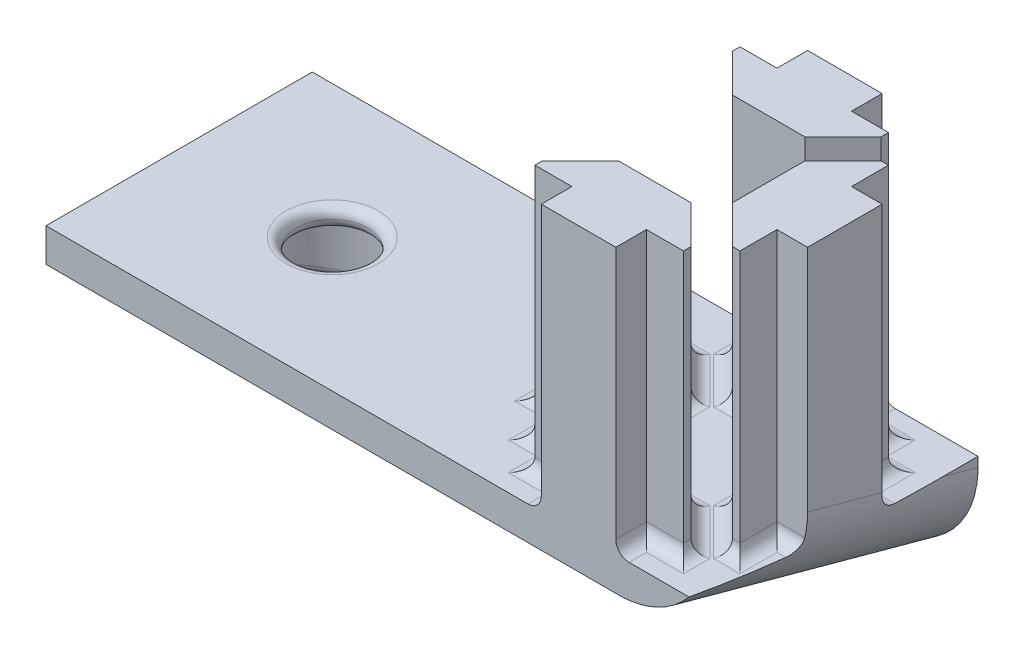
from build123d import *

# Parameters (mm, degrees)
BOSS_EXTRUDE1_DEPTH   = 20
BOSS_EXTRUDE1_2_DEPTH = 20
BOSS_EXTRUDE1_3_DEPTH = 20
BOSS_EXTRUDE1_4_DEPTH = 20
SKETCH2_W             = 20
SKETCH2_H             = 20
BOSS_EXTRUDE2_DEPTH   = 20
CUT_EXTRUDE1_DEPTH    = 31
BOSS_EXTRUDE3_DEPTH   = 30
FILLET1_R             = 7
CUT_EXTRUDE2_REACH    = 47.826
SKETCH5_R             = 2.7
CUT_EXTRUDE3_REACH    = 48.5
SKETCH6_R             = 5
FILLET5_R             = 1
FILLET6_R             = 0.75
CUT_EXTRUDE4_DEPTH    = 10


# Some blends are built 0.0001 mm under size
with BuildPart() as part:
    # Sketch1 → Boss-Extrude1 (new body)
    with BuildSketch(Plane(origin=(0, 0, 0), x_dir=(1, 0, 0), z_dir=(0, 1, 0))):
        Polygon((-10, -2.8), (-10, 2.8), (-7.7, 2.8), (-7.7, 5.58), (-7.135634919, 5.58), (-4.28, 2.724365081), (-4.28, -2.724365081), (-7.135634919, -5.58), (-7.7, -5.58), (-7.7, -2.8), align=None)
    extrude(amount=BOSS_EXTRUDE1_DEPTH)



with BuildPart() as body_2:
    # Sketch1 → Boss-Extrude1 2 (new body)
    with BuildSketch(Plane(origin=(0, 0, 0), x_dir=(1, 0, 0), z_dir=(0, 1, 0))):
        Polygon((10, 2.8), (7.7, 2.8), (7.7, 5.58), (7.135634919, 5.58), (4.28, 2.724365081), (4.28, -2.724365081), (7.135634919, -5.58), (7.7, -5.58), (7.7, -2.8), (10, -2.8), align=None)
    extrude(amount=BOSS_EXTRUDE1_2_DEPTH)


with BuildPart() as body_3:
    # Sketch1 → Boss-Extrude1 3 (new body)
    with BuildSketch(Plane(origin=(0, 0, 0), x_dir=(1, 0, 0), z_dir=(0, 1, 0))):
        Polygon((2.8, -10), (-2.8, -10), (-2.8, -7.7), (-5.58, -7.7), (-5.58, -7.135634919), (-2.724365081, -4.28), (2.724365081, -4.28), (5.58, -7.135634919), (5.58, -7.7), (2.8, -7.7), align=None)
    extrude(amount=BOSS_EXTRUDE1_3_DEPTH)


with BuildPart() as body_4:
    # Sketch1 → Boss-Extrude1 4 (new body)
    with BuildSketch(Plane(origin=(0, 0, 0), x_dir=(1, 0, 0), z_dir=(0, 1, 0))):
        Polygon((-2.8, 10), (-2.8, 7.7), (-5.58, 7.7), (-5.58, 7.135634919), (-2.724365081, 4.28), (2.724365081, 4.28), (5.58, 7.135634919), (5.58, 7.7), (2.8, 7.7), (2.8, 10), align=None)
    extrude(amount=BOSS_EXTRUDE1_4_DEPTH)


with BuildPart() as part_1:
    add(part.part)

    add(body_2.part)  # Boss-Extrude2 merges body 2

    add(body_3.part)  # Boss-Extrude2 merges body 3

    add(body_4.part)  # Boss-Extrude2 merges body 4
    # Sketch2 → Boss-Extrude2 (add)
    with BuildSketch(Plane.XZ):
        Rectangle(SKETCH2_W, SKETCH2_H)
    extrude(amount=BOSS_EXTRUDE2_DEPTH)

    # Sketch3 → Cut-Extrude1 (cut, through all)
    with BuildSketch(Plane(origin=(10, 0, 0), x_dir=(0, 0, -1), z_dir=(1, 0, 0))):
        Polygon((10.596673941, -8.137212268), (10.596673941, -38.345549702), (-10.411138478, -38.345549702), (-10.411138478, -2.402671747), align=None)
    extrude(amount=-CUT_EXTRUDE1_DEPTH, mode=Mode.SUBTRACT)

    # Sketch4 → Boss-Extrude3 (add)
    with BuildSketch(Plane.ZY.offset(10)):
        Polygon((10, 0), (-10, 0), (-10, -7.974337104), (10, -2.51490096), align=None)
    extrude(amount=BOSS_EXTRUDE3_DEPTH)

    # Fillet1
    # the kernel refuses this fillet: 7 mm, written as the material it takes off along each edge
    with BuildSketch(Plane(origin=(10, 2.093496024, 26.882318479), x_dir=(0, 0.9647039130954435, -0.26333697054978655), z_dir=(0, -0.26333697054978655, -0.9647039130954435))) as fillet1_piece_1:
        with BuildLine():
            CenterArc((FILLET1_R, -FILLET1_R), FILLET1_R, 90, 90)
            Line((0, -FILLET1_R), (0, 0))
            Line((0, 0), (FILLET1_R, 0))
        make_face()
    extrude(amount=55.731749637, mode=Mode.SUBTRACT)

    # Cut-Extrude2: up to this plane
    cut_extrude2_end = Plane(origin=(-10, -8.137212268, -10.596673941), z_dir=(0, 0.9647039130954435, -0.26333697054978655))
    # Sketch5 → Cut-Extrude2 (cut, up to the surface)
    with BuildSketch(Plane(origin=(0, 0, 0), x_dir=(1, 0, 0), z_dir=(0, 1, 0)), mode=Mode.PRIVATE) as cut_extrude2_sk1:
        with Locations(Location((-28.5, 0, 0), (0, 0, 270))):
            Circle(SKETCH5_R)
    cut_extrude2_tool1 = split(extrude(cut_extrude2_sk1.sketch, amount=-CUT_EXTRUDE2_REACH, mode=Mode.PRIVATE), bisect_by=cut_extrude2_end, keep=Keep.BOTH, mode=Mode.PRIVATE)
    add(cut_extrude2_tool1.solids().sort_by_distance((-28.5, 0, 0))[0], mode=Mode.SUBTRACT)

    # Cut-Extrude3: up to this plane
    cut_extrude3_end = Plane(origin=(-10, -8.137212268, -10.596673941), z_dir=(0, 0.9647039130954435, -0.26333697054978655))
    # Sketch6 → Cut-Extrude3 (cut, up to the surface)
    with BuildSketch(Plane(origin=(0, -1.5, 0), x_dir=(1, 0, 0), z_dir=(0, 1, 0)), mode=Mode.PRIVATE) as cut_extrude3_sk1:
        with Locations(Location((-28.5, 0, 0), (0, 0, 270))):
            Circle(SKETCH6_R)
    cut_extrude3_tool1 = split(extrude(cut_extrude3_sk1.sketch, amount=-CUT_EXTRUDE3_REACH, mode=Mode.PRIVATE), bisect_by=cut_extrude3_end, keep=Keep.BOTH, mode=Mode.PRIVATE)
    add(cut_extrude3_tool1.solids().sort_by_distance((-28.5, -1.5, 0))[0], mode=Mode.SUBTRACT)

    # Fillet5
    fillet5_edges = [part_1.edges().sort_by_distance(p)[0] for p in [
        (-4.28, 0, 0),
        (-5.707817459, 0, 4.152182541),
        (-7.417817459, 0, 5.58),
        (-7.7, 0, 4.19),
        (-8.85, 0, 2.8),
        (-10, 0, 0),
        (-8.85, 0, -2.8),
        (-7.7, 0, -4.19),
        (-5.707817459, 0, -4.152182541),
        (-7.417817459, 0, -5.58),
        (-2.8, 0, -8.85),
        (-4.19, 0, -7.7),
        (-5.58, 0, -7.417817459),
        (-4.152182541, 0, -5.707817459),
        (0, 0, -4.28),
        (4.152182541, 0, -5.707817459),
        (5.58, 0, -7.417817459),
        (4.19, 0, -7.7),
        (2.8, 0, -8.85),
        (8.79791333, 0, -2.8),
        (7.7, 0, -4.19),
        (7.417817459, 0, -5.58),
        (5.707817459, 0, -4.152182541),
        (4.28, 0, 0),
        (5.707817459, 0, 4.152182541),
        (7.417817459, 0, 5.58),
        (8.583774042, 0, 2.8),
        (7.7, 0, 4.19),
        (2.8, 0, 8.85),
        (4.19, 0, 7.7),
        (5.58, 0, 7.417817459),
        (4.152182541, 0, 5.707817459),
        (0, 0, 4.28),
        (-4.152182541, 0, 5.707817459),
        (-5.58, 0, 7.417817459),
        (-4.19, 0, 7.7),
        (-2.8, 0, 8.85),
    ]]
    fillet(fillet5_edges, radius=FILLET5_R)

    # Fillet6
    fillet6_edges = [part_1.edges().sort_by_distance(p)[0] for p in [
        (-28.5, 0, -2.7),
        (-28.5, -6.609478068, -5),
        (-28.5, -1.5, -2.7),
        (-28.5, -1.5, -5),
    ]]
    fillet(fillet6_edges, radius=FILLET6_R - 0.0001)  # a hair under: the kernel refuses the full size

    # Sketch7 → Cut-Extrude4 (cut)
    with BuildSketch(Plane(origin=(0, 20, 0), x_dir=(1, 0, 0), z_dir=(0, 1, 0))):
        Polygon((-7.555562818, 7.211994187), (-2.766940799, 2.423372169), (-2.766940799, -2.697134544), (-7.555562818, -7.485756562), (-13.102778423, -7.485756562), (-13.102778423, 7.211994187), align=None)
    extrude(amount=-CUT_EXTRUDE4_DEPTH, mode=Mode.SUBTRACT)


solid = part_1.part
